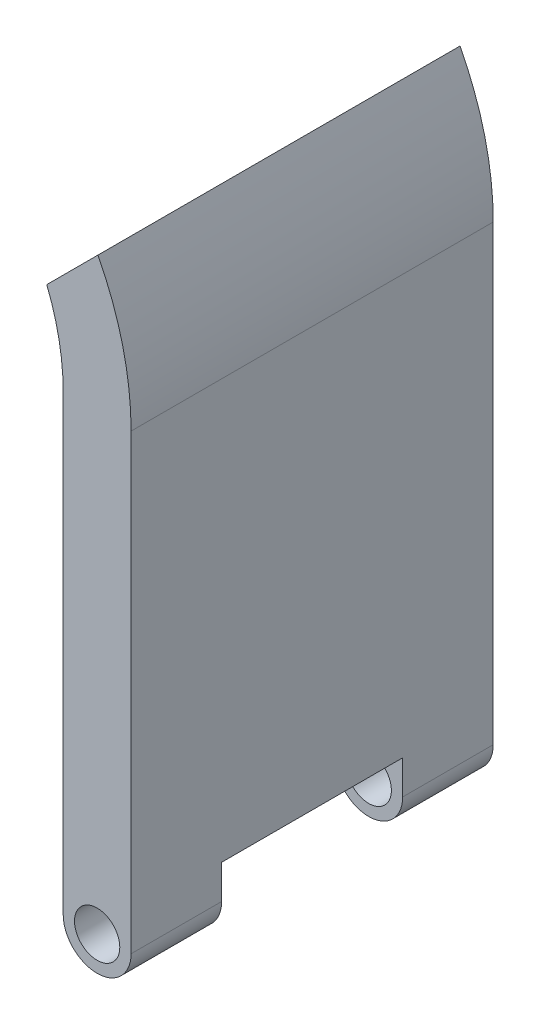
from build123d import *

# Parameters (mm, degrees)
SKETCH1_R           = 1
BOSS_EXTRUDE1_DEPTH = 16
CUT_EXTRUDE1_START  = 8
SKETCH4_R           = 0.5
SKETCH4_R_2         = 1
CUT_EXTRUDE1_DEPTH  = 8
FILLET1_R           = 10


with BuildPart() as part:
    # Sketch1 → Boss-Extrude1 (new body)
    with BuildSketch(Plane.XY):
        with BuildLine():
            ThreePointArc((0, 20), (-0.37218717, 23.088420816), (-1.467437405, 26))
            Line((-1.467437405, 26), (-3.726208596, 23.741228809))
            ThreePointArc((-3.726208596, 23.741228809), (-3.183230826, 21.90552958), (-3, 20))
            Line((-3, 20), (-3, 0))
            ThreePointArc((-3, 0), (-1.5, -1.5), (0, 0))
            Line((0, 0), (0, 20))
        make_face()
        with Locations((-1.5, 0)):
            Circle(SKETCH1_R, mode=Mode.SUBTRACT)
    extrude(amount=BOSS_EXTRUDE1_DEPTH)

    # Sketch4 → Cut-Extrude1 (cut)
    # profile 1 of 10: a face of its own
    with BuildSketch(Plane(origin=(0, 0, 12), x_dir=(-1, 0, 0), z_dir=(0, 0, -1)).offset(CUT_EXTRUDE1_START)):
        with Locations((1.5, 1.5)):
            Circle(SKETCH4_R)
    # profile 2 of 10: a face of its own
    with BuildSketch(Plane(origin=(0, 0, 12), x_dir=(-1, 0, 0), z_dir=(0, 0, -1)).offset(CUT_EXTRUDE1_START)):
        with BuildLine():
            ThreePointArc((3, 0), (1.5, 1.5), (0, 0))
            ThreePointArc((0, 0), (1.5, -1.5), (3, 0))
        make_face()
        with Locations((1.5, 0)):
            Circle(SKETCH4_R_2, mode=Mode.SUBTRACT)
    # profile 3 of 10: a face of its own
    with BuildSketch(Plane(origin=(0, 0, 12), x_dir=(-1, 0, 0), z_dir=(0, 0, -1)).offset(CUT_EXTRUDE1_START)):
        with BuildLine():
            ThreePointArc((1.993006649, 1.416666667), (2.722601728, 0.869048338), (3, 0))
            Line((3, 0), (3, 1.5))
            Line((3, 1.5), (2, 1.5))
            ThreePointArc((2, 1.5), (1.998248595, 1.45818687), (1.993006649, 1.416666667))
        make_face()
    # profile 4 of 10: a face of its own
    with BuildSketch(Plane(origin=(0, 0, 12), x_dir=(-1, 0, 0), z_dir=(0, 0, -1)).offset(CUT_EXTRUDE1_START)):
        with BuildLine():
            ThreePointArc((1.5, 1.5), (1.25, 1.479019946), (1.006993351, 1.416666667))
            ThreePointArc((1.006993351, 1.416666667), (1.177251388, 1.118118692), (1.5, 1))
            ThreePointArc((1.5, 1), (1.822748612, 1.118118692), (1.993006649, 1.416666667))
            ThreePointArc((1.993006649, 1.416666667), (1.75, 1.479019946), (1.5, 1.5))
        make_face()
    # profile 5 of 10: a face of its own
    with BuildSketch(Plane(origin=(0, 0, 12), x_dir=(-1, 0, 0), z_dir=(0, 0, -1)).offset(CUT_EXTRUDE1_START)):
        with BuildLine():
            Line((0, 1.5), (0, 0))
            ThreePointArc((0, 0), (0.277398272, 0.869048338), (1.006993351, 1.416666667))
            ThreePointArc((1.006993351, 1.416666667), (1.001751405, 1.45818687), (1, 1.5))
            Line((1, 1.5), (0, 1.5))
        make_face()
    # profile 6 of 10: a face of its own
    with BuildSketch(Plane(origin=(0, 0, 12), x_dir=(-1, 0, 0), z_dir=(0, 0, -1)).offset(CUT_EXTRUDE1_START)):
        with BuildLine():
            ThreePointArc((1, 1.5), (1.001751405, 1.45818687), (1.006993351, 1.416666667))
            ThreePointArc((1.006993351, 1.416666667), (1.25, 1.479019946), (1.5, 1.5))
            Line((1.5, 1.5), (1, 1.5))
        make_face()
    # profile 7 of 10: a face of its own
    with BuildSketch(Plane(origin=(0, 0, 12), x_dir=(-1, 0, 0), z_dir=(0, 0, -1)).offset(CUT_EXTRUDE1_START)):
        with BuildLine():
            ThreePointArc((1.5, 1.5), (1.75, 1.479019946), (1.993006649, 1.416666667))
            ThreePointArc((1.993006649, 1.416666667), (1.998248595, 1.45818687), (2, 1.5))
            Line((2, 1.5), (1.5, 1.5))
        make_face()
    # profile 8 of 10: a face of its own
    with BuildSketch(Plane(origin=(0, 0, 12), x_dir=(-1, 0, 0), z_dir=(0, 0, -1)).offset(CUT_EXTRUDE1_START)):
        with BuildLine():
            ThreePointArc((2, 1.5), (1.5, 2), (1, 1.5))
            Line((1, 1.5), (1.5, 1.5))
            Line((1.5, 1.5), (2, 1.5))
        make_face()
    # profile 9 of 10: a face of its own
    with BuildSketch(Plane(origin=(0, 0, 12), x_dir=(-1, 0, 0), z_dir=(0, 0, -1)).offset(CUT_EXTRUDE1_START)):
        with BuildLine():
            ThreePointArc((1, 1.5), (1.001751405, 1.45818687), (1.006993351, 1.416666667))
            ThreePointArc((1.006993351, 1.416666667), (1.25, 1.479019946), (1.5, 1.5))
            Line((1.5, 1.5), (1, 1.5))
        make_face()
    # profile 10 of 10: a face of its own
    with BuildSketch(Plane(origin=(0, 0, 12), x_dir=(-1, 0, 0), z_dir=(0, 0, -1)).offset(CUT_EXTRUDE1_START)):
        with BuildLine():
            ThreePointArc((1.5, 1.5), (1.75, 1.479019946), (1.993006649, 1.416666667))
            ThreePointArc((1.993006649, 1.416666667), (1.998248595, 1.45818687), (2, 1.5))
            Line((2, 1.5), (1.5, 1.5))
        make_face()
    extrude(amount=-CUT_EXTRUDE1_DEPTH, mode=Mode.SUBTRACT)

    # Fillet1
    # the kernel refuses this fillet: 10 mm, written as the material it takes off along each edge
    with BuildSketch(Plane(origin=(-2, 1.5, 4), x_dir=(-1, 0, 0), z_dir=(0, 0, 1))) as fillet1_piece_1:
        with BuildLine():
            CenterArc((3.666666667, -9.637888197), FILLET1_R, 105.466009953, 7.913858162)
            Line((-0.301587302, -0.458947057), (-0.380952381, -0.275368234))
            ThreePointArc((-0.380952381, -0.275368234), (-0.249286732, -0.164750894), (-0.2, 0))
            Line((-0.2, 0), (0, 0.2))
            ThreePointArc((0, 0.2), (0.5, 0.2), (0.946666667, 0.192757764))
            Line((0.946666667, 0.192757764), (1, 0))
        make_face()
    extrude(amount=8, mode=Mode.SUBTRACT)
    with BuildSketch(Plane(origin=(-1, 1.5, 4), x_dir=(-0.5491696473652747, 0.8357108940373459, 0), z_dir=(0, 0, 1))) as fillet1_piece_2:
        with BuildLine():
            CenterArc((6.040866121, -8.35710894), FILLET1_R, 123.310065942, 7.913858162)
            Line((-0.549169647, -0.835710894), (-0.680970363, -0.685282933))
            ThreePointArc((-0.680970363, -0.685282933), (-0.441727002, -0.308021518), (-0.167142179, 0.109833929))
            Line((-0.167142179, 0.109833929), (0.109833929, 0.167142179))
            ThreePointArc((0.109833929, 0.167142179), (0.274584824, 0.117855447), (0.439335718, 0.167142179))
            Line((0.439335718, 0.167142179), (0.549169647, 0))
        make_face()
    extrude(amount=8, mode=Mode.SUBTRACT)


solid = part.part
